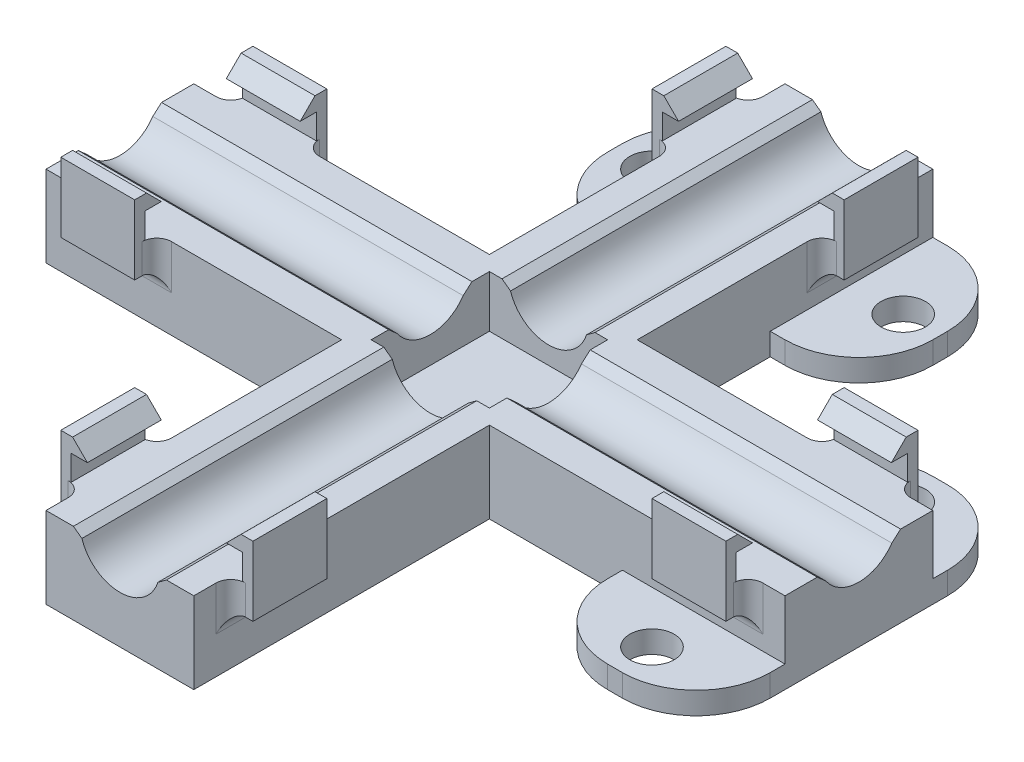
from build123d import *

# Parameters (mm, degrees)
BOSS_EXTRUDE5_DEPTH          = 5.5
CUT_EXTRUDE1_REACH           = 58.172
SKETCH4_R                    = 2.7
SKETCH5_R                    = 2.7
CUT_EXTRUDE2_DEPTH           = 57.171612047
SKETCH6_W                    = 8
SKETCH6_H                    = 8
CUT_EXTRUDE3_DEPTH           = 3.5
SKETCH7_W                    = 5
SKETCH7_H                    = 4.7
BOSS_EXTRUDE6_DEPTH          = 1.5
SKETCH8_W                    = 5
SKETCH8_H                    = 1
BOSS_EXTRUDE7_DEPTH          = 0.3
CHAMFER1_SIZE                = 1
CHAMFER1_OF_MIRROR2_SIZE     = 1
FILLET2_R                    = 1
SKETCH13_W                   = 5
SKETCH13_H                   = 1.7
CUT_EXTRUDE6_DEPTH           = 0.8
SKETCH9_W                    = 11
SKETCH9_H                    = 1.5
BOSS_EXTRUDE8_DEPTH          = 6
CUT_EXTRUDE5_REACH           = 38.294
SKETCH11_R                   = 1.5
CIRPATTERN12_COUNT           = 2
CIRPATTERN12_ANGLE           = 90
CIRPATTERN12_COPY_1_SKETCH_W = 11
CIRPATTERN12_COPY_1_SKETCH_H = 1.5
CIRPATTERN12_COPY_1_DEPTH    = 6
CIRPATTERN12_COPY_2_REACH    = 38.294
CIRPATTERN12_COPY_2_SKETCH_R = 1.5
FILLET4_R                    = 5
CIRPATTERN14_COUNT           = 4
CIRPATTERN14_COPY_1_SKETCH_W = 5
CIRPATTERN14_COPY_1_SKETCH_H = 1.7
CIRPATTERN14_COPY_1_DEPTH    = 0.8
CIRPATTERN14_COPY_2_SKETCH_W = 5
CIRPATTERN14_COPY_2_SKETCH_H = 1.7
CIRPATTERN14_COPY_2_DEPTH    = 0.8
CIRPATTERN14_COPY_3_SKETCH_W = 5
CIRPATTERN14_COPY_3_SKETCH_H = 1.7
CIRPATTERN14_COPY_3_DEPTH    = 0.8
CHAMFER2_START               = -26
CHAMFER2_DEPTH               = 52
CHAMFER2_2_DEPTH             = 52


with BuildPart() as part:
    # Sketch3 → Boss-Extrude5 (new body)
    with BuildSketch(Plane(origin=(0, 0, 0), x_dir=(1, 0, 0), z_dir=(0, 1, 0))):
        Polygon((5, 5), (25, 5), (25, -5), (5, -5), (5, -25), (-5, -25), (-5, -5), (-25, -5), (-25, 5), (-5, 5), (-5, 25), (5, 25), align=None)
    extrude(amount=BOSS_EXTRUDE5_DEPTH)

    # Sketch4 → Cut-Extrude1 (cut, up to next)
    with BuildSketch(Plane.XY.offset(25), mode=Mode.PRIVATE) as cut_extrude1_sk1:
        with Locations((0, 5.9)):
            Circle(SKETCH4_R)
    cut_extrude1_tool1 = extrude(cut_extrude1_sk1.sketch, amount=-CUT_EXTRUDE1_REACH, mode=Mode.PRIVATE) & part.part
    add(cut_extrude1_tool1.solids().sort_by_distance((0, 5.9, 25))[0], mode=Mode.SUBTRACT)

    # Sketch5 → Cut-Extrude2 (cut, through all)
    with BuildSketch(Plane(origin=(25, 0, 0), x_dir=(0, 0, -1), z_dir=(1, 0, 0))):
        with Locations((0, 6.5)):
            Circle(SKETCH5_R)
    extrude(amount=-CUT_EXTRUDE2_DEPTH, mode=Mode.SUBTRACT)

    # Sketch6 → Cut-Extrude3 (cut)
    with BuildSketch(Plane(origin=(0, 5.5, 0), x_dir=(1, 0, 0), z_dir=(0, 1, 0))):
        Rectangle(SKETCH6_W, SKETCH6_H)
    extrude(amount=-CUT_EXTRUDE3_DEPTH, mode=Mode.SUBTRACT)

    # Sketch7 → Boss-Extrude6 (add)
    with BuildSketch(Plane(origin=(5, 0, 0), x_dir=(0, 0, -1), z_dir=(1, 0, 0))):
        with Locations((-20, 5.85)):
            Rectangle(SKETCH7_W, SKETCH7_H)
    boss_extrude6 = extrude(amount=BOSS_EXTRUDE6_DEPTH)

    # Sketch8 → Boss-Extrude7 (add)
    with BuildSketch(Plane.ZY.offset(-5)):
        with Locations((20, 7.7)):
            Rectangle(SKETCH8_W, SKETCH8_H)
    boss_extrude7 = extrude(amount=BOSS_EXTRUDE7_DEPTH)

    # Chamfer1
    chamfer1_edges = [part.edges().sort_by_distance(p)[0] for p in [
        (4.7, 8.2, 20),
    ]]
    chamfer(chamfer1_edges, length=CHAMFER1_SIZE - 0.0001)  # a hair under: the kernel refuses the full size

    # Mirror2: Boss-Extrude6, Boss-Extrude7 across plane
    add(boss_extrude6.mirror(Plane(origin=(0, 0, 0), x_dir=(0, 0, 1), z_dir=(1, 0, 0))))
    add(boss_extrude7.mirror(Plane(origin=(0, 0, 0), x_dir=(0, 0, 1), z_dir=(1, 0, 0))))

    # Chamfer1 of Mirror2
    chamfer1_of_mirror2_edges = [part.edges().sort_by_distance(p)[0] for p in [
        (-4.7, 8.2, 20),
    ]]
    chamfer(chamfer1_of_mirror2_edges, length=CHAMFER1_OF_MIRROR2_SIZE - 0.0001)  # a hair under: the kernel refuses the full size

    # CirPattern6: read off the stored shape, not the designer's step
    # CirPattern6: loft between two sections, ruled curve by curve
    cirpattern6_from = [
        Edge.make_line((-17.5, 7.2, 5), (-17.5, 5.5, 5)),
        Edge.make_line((-17.5, 8.2, 6.5), (-17.5, 8.2, 5.7)),
        Edge.make_line((-17.5, 3.5, 5), (-17.5, 3.5, 6.5)),
        Edge.make_line((-17.5, 7.2, 5), (-17.5, 7.2, 4.7)),
        Edge.make_line((-17.5, 3.5, 6.5), (-17.5, 8.2, 6.5)),
        Edge.make_line((-17.5, 8.2, 5.7), (-17.5, 7.2, 4.7)),
        Edge.make_line((-17.5, 3.5, 5), (-17.5, 5.5, 5)),
    ]
    cirpattern6_to = [
        Edge.make_line((-22.5, 7.2, 5), (-22.5, 5.5, 5)),
        Edge.make_line((-22.5, 8.2, 6.5), (-22.5, 8.2, 5.7)),
        Edge.make_line((-22.5, 3.5, 5), (-22.5, 3.5, 6.5)),
        Edge.make_line((-22.5, 7.2, 5), (-22.5, 7.2, 4.7)),
        Edge.make_line((-22.5, 3.5, 6.5), (-22.5, 8.2, 6.5)),
        Edge.make_line((-22.5, 8.2, 5.7), (-22.5, 7.2, 4.7)),
        Edge.make_line((-22.5, 3.5, 5), (-22.5, 5.5, 5)),
    ]
    cirpattern6 = Solid(Shell([*[Face.make_surface_from_curves(cirpattern6_from[k], cirpattern6_to[k]) for k in range(7)], Face(Wire(cirpattern6_from)), Face(Wire(cirpattern6_to))]))
    add(cirpattern6)

    # CirPattern6 2: loft between two sections, ruled curve by curve
    cirpattern6_2_from = [
        Edge.make_line((22.5, 5.5, 5), (22.5, 7.2, 5)),
        Edge.make_line((22.5, 8.2, 6.5), (22.5, 8.2, 5.7)),
        Edge.make_line((22.5, 3.5, 5), (22.5, 3.5, 6.5)),
        Edge.make_line((22.5, 7.2, 5), (22.5, 7.2, 4.7)),
        Edge.make_line((22.5, 3.5, 6.5), (22.5, 8.2, 6.5)),
        Edge.make_line((22.5, 7.2, 4.7), (22.5, 8.2, 5.7)),
        Edge.make_line((22.5, 3.5, 5), (22.5, 5.5, 5)),
    ]
    cirpattern6_2_to = [
        Edge.make_line((17.5, 5.5, 5), (17.5, 7.2, 5)),
        Edge.make_line((17.5, 8.2, 6.5), (17.5, 8.2, 5.7)),
        Edge.make_line((17.5, 3.5, 5), (17.5, 3.5, 6.5)),
        Edge.make_line((17.5, 7.2, 5), (17.5, 7.2, 4.7)),
        Edge.make_line((17.5, 3.5, 6.5), (17.5, 8.2, 6.5)),
        Edge.make_line((17.5, 7.2, 4.7), (17.5, 8.2, 5.7)),
        Edge.make_line((17.5, 3.5, 5), (17.5, 5.5, 5)),
    ]
    cirpattern6_2 = Solid(Shell([*[Face.make_surface_from_curves(cirpattern6_2_from[k], cirpattern6_2_to[k]) for k in range(7)], Face(Wire(cirpattern6_2_from)), Face(Wire(cirpattern6_2_to))]))
    add(cirpattern6_2)

    # CirPattern6 3: loft between two sections, ruled curve by curve
    cirpattern6_3_from = [
        Edge.make_line((-5, 7.2, -22.5), (-5, 5.5, -22.5)),
        Edge.make_line((-5.7, 8.2, -22.5), (-6.5, 8.2, -22.5)),
        Edge.make_line((-5, 3.5, -22.5), (-6.5, 3.5, -22.5)),
        Edge.make_line((-5, 7.2, -22.5), (-4.7, 7.2, -22.5)),
        Edge.make_line((-6.5, 8.2, -22.5), (-6.5, 3.5, -22.5)),
        Edge.make_line((-4.7, 7.2, -22.5), (-5.7, 8.2, -22.5)),
        Edge.make_line((-5, 3.5, -22.5), (-5, 5.5, -22.5)),
    ]
    cirpattern6_3_to = [
        Edge.make_line((-5, 7.2, -17.5), (-5, 5.5, -17.5)),
        Edge.make_line((-5.7, 8.2, -17.5), (-6.5, 8.2, -17.5)),
        Edge.make_line((-5, 3.5, -17.5), (-6.5, 3.5, -17.5)),
        Edge.make_line((-5, 7.2, -17.5), (-4.7, 7.2, -17.5)),
        Edge.make_line((-6.5, 8.2, -17.5), (-6.5, 3.5, -17.5)),
        Edge.make_line((-4.7, 7.2, -17.5), (-5.7, 8.2, -17.5)),
        Edge.make_line((-5, 3.5, -17.5), (-5, 5.5, -17.5)),
    ]
    cirpattern6_3 = Solid(Shell([*[Face.make_surface_from_curves(cirpattern6_3_from[k], cirpattern6_3_to[k]) for k in range(7)], Face(Wire(cirpattern6_3_from)), Face(Wire(cirpattern6_3_to))]))
    add(cirpattern6_3)

    # CirPattern6 4: loft between two sections, ruled curve by curve
    cirpattern6_4_from = [
        Edge.make_line((22.5, 7.2, -5), (22.5, 5.5, -5)),
        Edge.make_line((22.5, 8.2, -5.7), (22.5, 8.2, -6.5)),
        Edge.make_line((22.5, 3.5, -5), (22.5, 3.5, -6.5)),
        Edge.make_line((22.5, 7.2, -5), (22.5, 7.2, -4.7)),
        Edge.make_line((22.5, 8.2, -6.5), (22.5, 3.5, -6.5)),
        Edge.make_line((22.5, 7.2, -4.7), (22.5, 8.2, -5.7)),
        Edge.make_line((22.5, 3.5, -5), (22.5, 5.5, -5)),
    ]
    cirpattern6_4_to = [
        Edge.make_line((17.5, 7.2, -5), (17.5, 5.5, -5)),
        Edge.make_line((17.5, 8.2, -5.7), (17.5, 8.2, -6.5)),
        Edge.make_line((17.5, 3.5, -5), (17.5, 3.5, -6.5)),
        Edge.make_line((17.5, 7.2, -5), (17.5, 7.2, -4.7)),
        Edge.make_line((17.5, 8.2, -6.5), (17.5, 3.5, -6.5)),
        Edge.make_line((17.5, 7.2, -4.7), (17.5, 8.2, -5.7)),
        Edge.make_line((17.5, 3.5, -5), (17.5, 5.5, -5)),
    ]
    cirpattern6_4 = Solid(Shell([*[Face.make_surface_from_curves(cirpattern6_4_from[k], cirpattern6_4_to[k]) for k in range(7)], Face(Wire(cirpattern6_4_from)), Face(Wire(cirpattern6_4_to))]))
    add(cirpattern6_4)

    # CirPattern6 5: loft between two sections, ruled curve by curve
    cirpattern6_5_from = [
        Edge.make_line((-17.5, 5.5, -5), (-17.5, 7.2, -5)),
        Edge.make_line((-17.5, 8.2, -6.5), (-17.5, 8.2, -5.7)),
        Edge.make_line((-17.5, 3.5, -5), (-17.5, 3.5, -6.5)),
        Edge.make_line((-17.5, 7.2, -5), (-17.5, 7.2, -4.7)),
        Edge.make_line((-17.5, 3.5, -6.5), (-17.5, 8.2, -6.5)),
        Edge.make_line((-17.5, 7.2, -4.7), (-17.5, 8.2, -5.7)),
        Edge.make_line((-17.5, 3.5, -5), (-17.5, 5.5, -5)),
    ]
    cirpattern6_5_to = [
        Edge.make_line((-22.5, 5.5, -5), (-22.5, 7.2, -5)),
        Edge.make_line((-22.5, 8.2, -6.5), (-22.5, 8.2, -5.7)),
        Edge.make_line((-22.5, 3.5, -5), (-22.5, 3.5, -6.5)),
        Edge.make_line((-22.5, 7.2, -5), (-22.5, 7.2, -4.7)),
        Edge.make_line((-22.5, 3.5, -6.5), (-22.5, 8.2, -6.5)),
        Edge.make_line((-22.5, 7.2, -4.7), (-22.5, 8.2, -5.7)),
        Edge.make_line((-22.5, 3.5, -5), (-22.5, 5.5, -5)),
    ]
    cirpattern6_5 = Solid(Shell([*[Face.make_surface_from_curves(cirpattern6_5_from[k], cirpattern6_5_to[k]) for k in range(7)], Face(Wire(cirpattern6_5_from)), Face(Wire(cirpattern6_5_to))]))
    add(cirpattern6_5)

    # CirPattern6 6: loft between two sections, ruled curve by curve
    cirpattern6_6_from = [
        Edge.make_line((5, 5.5, -22.5), (5, 7.2, -22.5)),
        Edge.make_line((6.5, 8.2, -22.5), (5.7, 8.2, -22.5)),
        Edge.make_line((5, 3.5, -22.5), (6.5, 3.5, -22.5)),
        Edge.make_line((6.5, 3.5, -22.5), (6.5, 8.2, -22.5)),
        Edge.make_line((5, 7.2, -22.5), (4.7, 7.2, -22.5)),
        Edge.make_line((4.7, 7.2, -22.5), (5.7, 8.2, -22.5)),
        Edge.make_line((5, 3.5, -22.5), (5, 5.5, -22.5)),
    ]
    cirpattern6_6_to = [
        Edge.make_line((5, 5.5, -17.5), (5, 7.2, -17.5)),
        Edge.make_line((6.5, 8.2, -17.5), (5.7, 8.2, -17.5)),
        Edge.make_line((5, 3.5, -17.5), (6.5, 3.5, -17.5)),
        Edge.make_line((6.5, 3.5, -17.5), (6.5, 8.2, -17.5)),
        Edge.make_line((5, 7.2, -17.5), (4.7, 7.2, -17.5)),
        Edge.make_line((4.7, 7.2, -17.5), (5.7, 8.2, -17.5)),
        Edge.make_line((5, 3.5, -17.5), (5, 5.5, -17.5)),
    ]
    cirpattern6_6 = Solid(Shell([*[Face.make_surface_from_curves(cirpattern6_6_from[k], cirpattern6_6_to[k]) for k in range(7)], Face(Wire(cirpattern6_6_from)), Face(Wire(cirpattern6_6_to))]))
    add(cirpattern6_6)

    # Fillet2
    fillet2_edges = [part.edges().sort_by_distance(p)[0] for p in [
        (-5, 4.5, 22.5),
        (-5, 4.5, 17.5),
        (-5, 3.5, 20),
        (22.5, 4.5, 5),
        (17.5, 4.5, 5),
        (20, 3.5, 5),
        (5, 4.5, -17.5),
        (5, 4.5, -22.5),
        (5, 3.5, -20),
        (-22.5, 4.5, -5),
        (-17.5, 4.5, -5),
        (-20, 3.5, -5),
        (17.5, 4.5, -5),
        (22.5, 4.5, -5),
        (20, 3.5, -5),
        (-5, 4.5, -22.5),
        (-5, 4.5, -17.5),
        (-5, 3.5, -20),
        (-22.5, 4.5, 5),
        (-17.5, 4.5, 5),
        (-20, 3.5, 5),
        (5, 4.5, 22.5),
        (5, 4.5, 17.5),
        (5, 3.5, 20),
    ]]
    fillet(fillet2_edges, radius=FILLET2_R)

    # Sketch13 → Cut-Extrude6 (cut)
    with BuildSketch(Plane.ZY.offset(-5)):
        with Locations((20, 6.35)):
            Rectangle(SKETCH13_W, SKETCH13_H)
    cut_extrude6 = extrude(amount=-CUT_EXTRUDE6_DEPTH, mode=Mode.SUBTRACT)

    # Sketch9 → Boss-Extrude8 (add)
    with BuildSketch(Plane(origin=(0, 0, -5), x_dir=(-1, 0, 0), z_dir=(0, 0, -1))):
        with Locations((-19.5, 0.75)):
            Rectangle(SKETCH9_W, SKETCH9_H)
    boss_extrude8 = extrude(amount=BOSS_EXTRUDE8_DEPTH)

    # Sketch11 → Cut-Extrude5 (cut, up to next)
    with BuildSketch(Plane.XZ, mode=Mode.PRIVATE) as cut_extrude5_sk1:
        with Locations(Location((19.5, -8.5, 0), (0, 0, 270))):
            Circle(SKETCH11_R)
    cut_extrude5_tool1 = extrude(cut_extrude5_sk1.sketch, amount=-CUT_EXTRUDE5_REACH, mode=Mode.PRIVATE) & part.part
    cut_extrude5 = cut_extrude5_tool1.solids().sort_by_distance((19.5, 0, -8.5))[0]
    add(cut_extrude5, mode=Mode.SUBTRACT)

    # Mirror3: Boss-Extrude8, Cut-Extrude5 across plane
    add(boss_extrude8.mirror(Plane.XY))
    add(cut_extrude5.mirror(Plane.XY), mode=Mode.SUBTRACT)

    # CirPattern12: Boss-Extrude8, Cut-Extrude5 ×2 about axis
    cirpattern12_axis = Axis((0, 0, 0), (0, 1, 0))
    add([boss_extrude8.rotate(cirpattern12_axis, i * CIRPATTERN12_ANGLE / (CIRPATTERN12_COUNT - 1)) for i in range(1, CIRPATTERN12_COUNT)])
    add([cut_extrude5.rotate(cirpattern12_axis, i * CIRPATTERN12_ANGLE / (CIRPATTERN12_COUNT - 1)) for i in range(1, CIRPATTERN12_COUNT)], mode=Mode.SUBTRACT)

    # CirPattern12 copy 1 sketch → CirPattern12 copy 1 (add)
    with BuildSketch(Plane(origin=(5, 0, 0), x_dir=(0, 0, 1), z_dir=(1, 0, 0))):
        with Locations((-19.5, -0.75)):
            Rectangle(CIRPATTERN12_COPY_1_SKETCH_W, CIRPATTERN12_COPY_1_SKETCH_H)
    extrude(amount=CIRPATTERN12_COPY_1_DEPTH)

    # CirPattern12 copy 2 sketch → CirPattern12 copy 2 (cut, up to next)
    with BuildSketch(Plane(origin=(0, 0, 0), x_dir=(0, 0, -1), z_dir=(0, -1, 0)), mode=Mode.PRIVATE) as cirpattern12_copy_2_sk1:
        with Locations((19.5, 8.5)):
            Circle(CIRPATTERN12_COPY_2_SKETCH_R)
    cirpattern12_copy_2_tool1 = extrude(cirpattern12_copy_2_sk1.sketch, amount=-CIRPATTERN12_COPY_2_REACH, mode=Mode.PRIVATE) & part.part
    add(cirpattern12_copy_2_tool1.solids().sort_by_distance((8.5, 0, -19.5))[0], mode=Mode.SUBTRACT)

    # Fillet4
    fillet4_edges = [part.edges().sort_by_distance(p)[0] for p in [
        (14, 0.75, -11),
        (25, 0.75, -11),
        (14, 0.75, 11),
        (25, 0.75, 11),
        (11, 0.75, -14),
        (11, 0.75, -25),
        (-11, 0.75, -14),
        (-11, 0.75, -25),
    ]]
    fillet(fillet4_edges, radius=FILLET4_R)

    # Mirror4: Cut-Extrude6 across plane
    add(cut_extrude6.mirror(Plane(origin=(0, 0, 0), x_dir=(0, 0, 1), z_dir=(1, 0, 0))), mode=Mode.SUBTRACT)

    # CirPattern14: Cut-Extrude6 ×4 about axis
    cirpattern14_axis = Axis((0, 0, 0), (0, 1, 0))
    for i in range(1, CIRPATTERN14_COUNT):
        add(cut_extrude6.rotate(cirpattern14_axis, i * 360 / CIRPATTERN14_COUNT), mode=Mode.SUBTRACT)

    # CirPattern14 copy 1 sketch → CirPattern14 copy 1 (cut)
    with BuildSketch(Plane(origin=(0, 0, 5), x_dir=(1, 0, 0), z_dir=(0, 0, -1))):
        with Locations((20, -6.35)):
            Rectangle(CIRPATTERN14_COPY_1_SKETCH_W, CIRPATTERN14_COPY_1_SKETCH_H)
    extrude(amount=-CIRPATTERN14_COPY_1_DEPTH, mode=Mode.SUBTRACT)

    # CirPattern14 copy 2 sketch → CirPattern14 copy 2 (cut)
    with BuildSketch(Plane(origin=(5, 0, 0), x_dir=(0, 0, -1), z_dir=(-1, 0, 0))):
        with Locations((20, -6.35)):
            Rectangle(CIRPATTERN14_COPY_2_SKETCH_W, CIRPATTERN14_COPY_2_SKETCH_H)
    extrude(amount=-CIRPATTERN14_COPY_2_DEPTH, mode=Mode.SUBTRACT)

    # CirPattern14 copy 3 sketch → CirPattern14 copy 3 (cut)
    with BuildSketch(Plane(origin=(0, 0, -5), x_dir=(-1, 0, 0), z_dir=(0, 0, 1))):
        with Locations((20, -6.35)):
            Rectangle(CIRPATTERN14_COPY_3_SKETCH_W, CIRPATTERN14_COPY_3_SKETCH_H)
    extrude(amount=-CIRPATTERN14_COPY_3_DEPTH, mode=Mode.SUBTRACT)

    # Chamfer2: read off the stored shape, not the designer's step
    # Chamfer2 outline → Chamfer2 (cut)
    with BuildSketch(Plane.YZ.offset(CHAMFER2_START)):
        with BuildLine():
            Line((5.5, 2.507987241), (5.5, 2.818415652))
            Line((5.5, 2.818415652), (4.974212995, 2.227548881))
            ThreePointArc((4.974212995, 2.227548881), (5.229346067, 2.382317902), (5.5, 2.507987241))
        make_face()
        with BuildLine():
            ThreePointArc((5.5, -2.507987241), (5.229346067, -2.382317902), (4.974212995, -2.227548881))
            Line((4.974212995, -2.227548881), (5.5, -2.818415652))
            Line((5.5, -2.818415652), (5.5, -2.507987241))
        make_face()
    extrude(amount=CHAMFER2_DEPTH, mode=Mode.SUBTRACT)

    # Chamfer2 2 outline → Chamfer2 2 (cut)
    with BuildSketch(Plane.XY.offset(CHAMFER2_START)):
        with BuildLine():
            ThreePointArc((2.670205985, 5.5), (2.629105515, 5.285342215), (2.570778016, 5.074711932))
            Line((2.570778016, 5.074711932), (3.145933741, 5.5))
            Line((3.145933741, 5.5), (2.670205985, 5.5))
        make_face()
        with BuildLine():
            Line((-3.145933741, 5.5), (-2.570778016, 5.074711932))
            ThreePointArc((-2.570778016, 5.074711932), (-2.629105515, 5.285342215), (-2.670205985, 5.5))
            Line((-2.670205985, 5.5), (-3.145933741, 5.5))
        make_face()
    extrude(amount=CHAMFER2_2_DEPTH, mode=Mode.SUBTRACT)


solid = part.part
